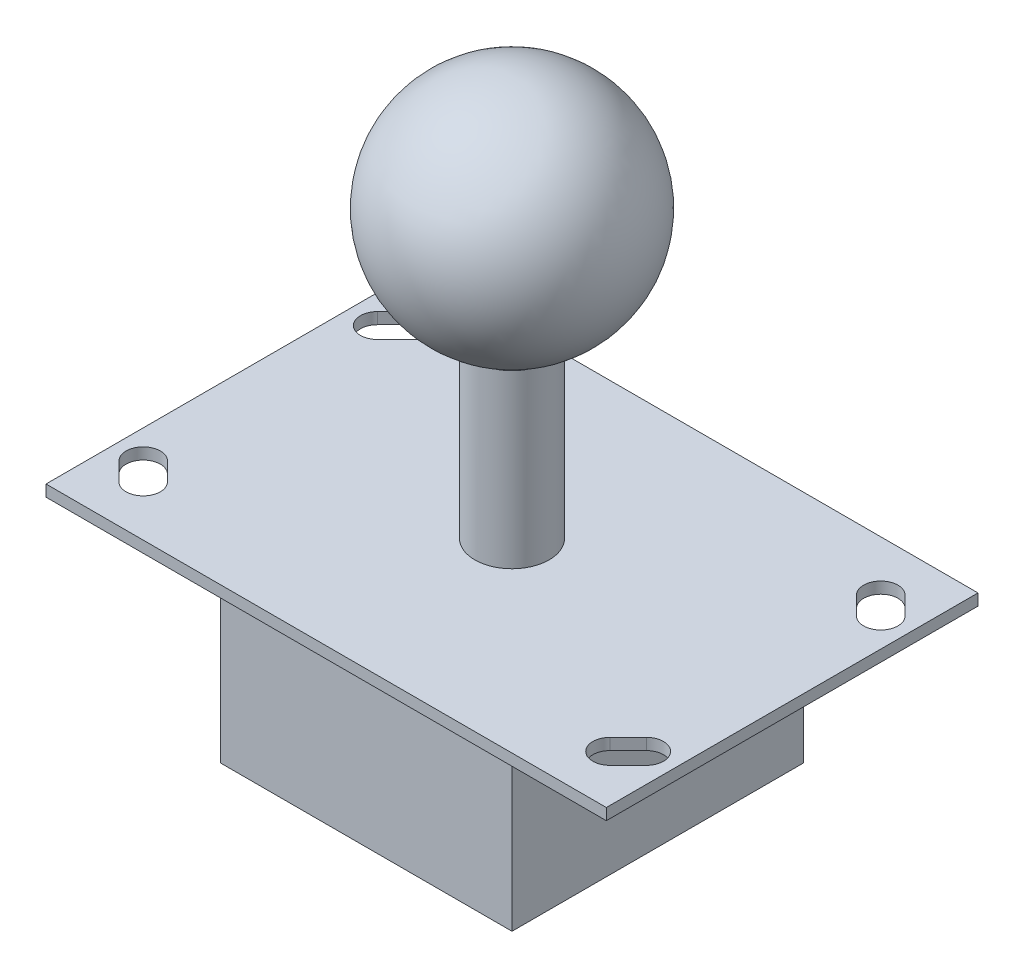
from build123d import *

# Parameters (mm, degrees)
SKETCH3_R           = 6.5
BOSS_EXTRUDE2_DEPTH = 30
SKETCH4_W           = 98
SKETCH4_H           = 65
BOSS_EXTRUDE3_DEPTH = 2
SKETCH5_W           = 51
SKETCH5_H           = 51
BOSS_EXTRUDE4_DEPTH = 32
CUT_EXTRUDE1_DEPTH  = 68.920909888


with BuildPart() as part:
    # Sketch3 → Boss-Extrude2 (new body)
    with BuildSketch(Plane(origin=(0, 0, 0), x_dir=(1, 0, 0), z_dir=(0, 1, 0))):
        Circle(SKETCH3_R)
    extrude(amount=BOSS_EXTRUDE2_DEPTH)

    # Sketch4 → Boss-Extrude3 (add)
    with BuildSketch(Plane(origin=(0, 0, 0), x_dir=(-1, 0, 0), z_dir=(0, -1, 0))):
        Rectangle(SKETCH4_W, SKETCH4_H)
    extrude(amount=BOSS_EXTRUDE3_DEPTH)

    # Sketch5 → Boss-Extrude4 (add)
    with BuildSketch(Plane.XZ.offset(2)):
        Rectangle(SKETCH5_W, SKETCH5_H)
    extrude(amount=BOSS_EXTRUDE4_DEPTH)

    # Sketch7 → Cut-Extrude1 (cut, through all)
    with BuildSketch(Plane(origin=(0, 0, 0), x_dir=(1, 0, 0), z_dir=(0, 1, 0))):
        with BuildLine():
            Line((-46.121320344, 22.621320344), (-42.939339828, 25.803300859))
            ThreePointArc((-42.939339828, 25.803300859), (-38.696699141, 25.803300859), (-38.696699141, 21.560660172))
            Line((-38.696699141, 21.560660172), (-41.878679656, 18.378679656))
            ThreePointArc((-41.878679656, 18.378679656), (-46.121320344, 18.378679656), (-46.121320344, 22.621320344))
        make_face()
        with BuildLine():
            Line((-46.121320344, -22.621320344), (-42.939339828, -25.803300859))
            ThreePointArc((-42.939339828, -25.803300859), (-38.696699141, -25.803300859), (-38.696699141, -21.560660172))
            Line((-38.696699141, -21.560660172), (-41.878679656, -18.378679656))
            ThreePointArc((-41.878679656, -18.378679656), (-46.121320344, -18.378679656), (-46.121320344, -22.621320344))
        make_face()
        with BuildLine():
            Line((41.878679656, -18.378679656), (38.696699141, -21.560660172))
            ThreePointArc((38.696699141, -21.560660172), (38.696699141, -25.803300859), (42.939339828, -25.803300859))
            Line((42.939339828, -25.803300859), (46.121320344, -22.621320344))
            ThreePointArc((46.121320344, -22.621320344), (46.121320344, -18.378679656), (41.878679656, -18.378679656))
        make_face()
        with BuildLine():
            Line((46.121320344, 22.621320344), (42.939339828, 25.803300859))
            ThreePointArc((42.939339828, 25.803300859), (38.696699141, 25.803300859), (38.696699141, 21.560660172))
            Line((38.696699141, 21.560660172), (41.878679656, 18.378679656))
            ThreePointArc((41.878679656, 18.378679656), (46.121320344, 18.378679656), (46.121320344, 22.621320344))
        make_face()
    extrude(amount=-CUT_EXTRUDE1_DEPTH, mode=Mode.SUBTRACT)


with BuildPart() as body_2:
    # 3DSketch1 → Revolve3 (revolve)
    with BuildSketch(Plane(origin=(0, 70, 0), x_dir=(0, -1, 0), z_dir=(-1, 0, 0))):
        with BuildLine():
            Line((0, 0), (40, 0))
            ThreePointArc((40, 0), (20, 20), (0, 0))
        make_face()
    revolve(axis=Axis((0, 30, 0), (0, 1, 0)))


solid = Compound([part.part, body_2.part])
